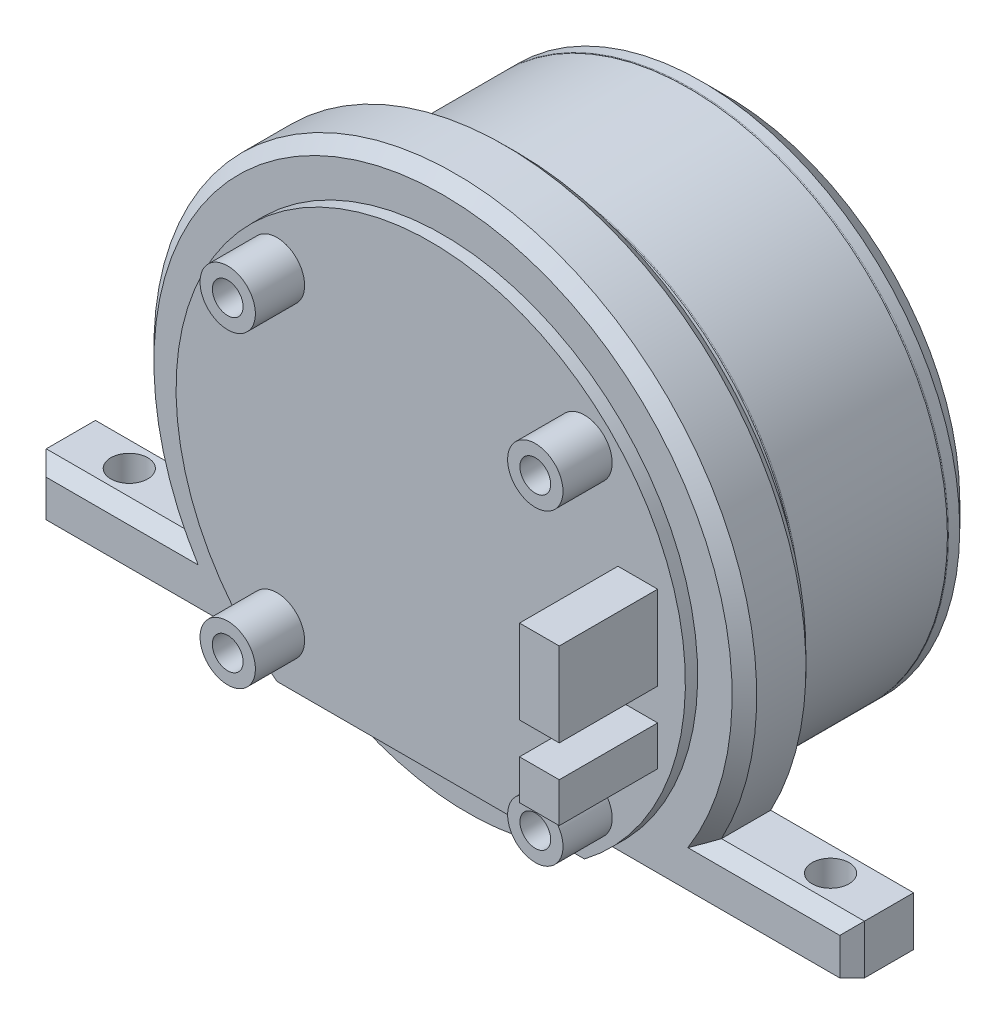
from build123d import *

# Parameters (mm, degrees)
SKETCH1_R               = 21
BOSS_EXTRUDE1_DEPTH     = 3
CHAMFER1_SIZE           = 2
FILLET1_R               = 0.1
SKETCH2_R               = 21
BOSS_EXTRUDE2_DEPTH     = 12
FILLET2_R               = 0.1
SKETCH3_R               = 21
BOSS_EXTRUDE3_DEPTH     = 6
SKETCH4_R               = 3
SKETCH4_R_2             = 1.5
CUT_EXTRUDE1_DEPTH      = 6
BOSS_EXTRUDE4_DEPTH     = 6
CHAMFER2_SIZE           = 1
CUT_EXTRUDE2_DEPTH      = 55.134670037
CUT_EXTRUDE2_DEPTH_BACK = 55.134670037
SKETCH6_R               = 1.5
BOSS_EXTRUDE5_DEPTH     = 1
SKETCH8_R               = 2.25
BOSS_EXTRUDE6_DEPTH     = 4
SKETCH9_R               = 1.25
CUT_EXTRUDE3_DEPTH      = 4
SKETCH10_W              = 3.229244049
SKETCH10_H              = 6.822780719
SKETCH10_H_2            = 3.229244049
BOSS_EXTRUDE7_DEPTH     = 8


with BuildPart() as part:
    # Sketch1 → Boss-Extrude1 (new body)
    with BuildSketch(Plane.XY):
        Circle(SKETCH1_R)
    extrude(amount=BOSS_EXTRUDE1_DEPTH)

    # Chamfer1
    chamfer1_edges = [part.edges().sort_by_distance(p)[0] for p in [
        (-21, 0, 0),
    ]]
    chamfer(chamfer1_edges, length=CHAMFER1_SIZE)

    # Fillet1
    fillet1_edges = [part.edges().sort_by_distance(p)[0] for p in [
        (-21, 0, 3),
    ]]
    fillet(fillet1_edges, radius=FILLET1_R)

    # Sketch2 → Boss-Extrude2 (add)
    with BuildSketch(Plane.XY.offset(3)):
        Circle(SKETCH2_R)
    extrude(amount=BOSS_EXTRUDE2_DEPTH)

    # Fillet2
    fillet2_edges = [part.edges().sort_by_distance(p)[0] for p in [
        (-21, 0, 15),
    ]]
    fillet(fillet2_edges, radius=FILLET2_R)

    # Sketch3 → Boss-Extrude3 (add)
    with BuildSketch(Plane.XY.offset(15)):
        Circle(SKETCH3_R)
    extrude(amount=BOSS_EXTRUDE3_DEPTH)

    # Sketch4 → Cut-Extrude1 (cut)
    with BuildSketch(Plane(origin=(0, 0, 0), x_dir=(-1, 0, 0), z_dir=(0, 0, -1))):
        Circle(SKETCH4_R)
        with Locations((-10, 0)):
            Circle(SKETCH4_R_2)
        with Locations((0, 10)):
            Circle(SKETCH4_R_2)
        with Locations((10, 0)):
            Circle(SKETCH4_R_2)
        with Locations((0, -10)):
            Circle(SKETCH4_R_2)
    extrude(amount=-CUT_EXTRUDE1_DEPTH, mode=Mode.SUBTRACT)

    # Sketch5 → Boss-Extrude4 (add)
    with BuildSketch(Plane.XY.offset(17)):
        with BuildLine():
            Line((21.633307653, -11.5), (33.25, -11.5))
            Line((33.25, -11.5), (33.25, -15.5))
            Line((33.25, -15.5), (-33.25, -15.5))
            Line((-33.25, -15.5), (-33.25, -11.5))
            Line((-33.25, -11.5), (-21.633307653, -11.5))
            ThreePointArc((-21.633307653, -11.5), (0, 24.5), (21.633307653, -11.5))
        make_face()
    extrude(amount=BOSS_EXTRUDE4_DEPTH)

    # Chamfer2
    chamfer2_edges = [part.edges().sort_by_distance(p)[0] for p in [
        (0, 24.5, 17),
        (0, 24.5, 23),
        (-33.25, -13.5, 17),
        (-27.441653826, -11.5, 17),
        (33.25, -13.5, 17),
        (27.441653826, -11.5, 17),
        (-33.25, -13.5, 23),
        (-27.441653826, -11.5, 23),
        (33.25, -13.5, 23),
        (27.441653826, -11.5, 23),
    ]]
    chamfer(chamfer2_edges, length=CHAMFER2_SIZE)

    # Sketch6 → Cut-Extrude2 (cut, two sides: drawn at the far end of the back side and taken through both)
    with BuildSketch(Plane(origin=(0, -11.5, 0), x_dir=(1, 0, 0), z_dir=(0, 1, 0)).offset(-CUT_EXTRUDE2_DEPTH_BACK)):
        with Locations((-28.5, -20)):
            Circle(SKETCH6_R)
        with Locations((28.5, -20)):
            Circle(SKETCH6_R)
    extrude(amount=CUT_EXTRUDE2_DEPTH + CUT_EXTRUDE2_DEPTH_BACK, mode=Mode.SUBTRACT)

    # Sketch7 → Boss-Extrude5 (add)
    with BuildSketch(Plane.XY.offset(23)):
        with BuildLine():
            Line((12.499599994, -16.5), (-12.499599994, -16.5))
            ThreePointArc((-12.499599994, -16.5), (0, 20.7), (12.499599994, -16.5))
        make_face()
    extrude(amount=BOSS_EXTRUDE5_DEPTH)

    # Sketch8 → Boss-Extrude6 (add)
    with BuildSketch(Plane.XY.offset(24)):
        with Locations((-12.5, 12.5)):
            Circle(SKETCH8_R)
        with Locations((12.5, 12.5)):
            Circle(SKETCH8_R)
        with Locations((12.5, -12.5)):
            Circle(SKETCH8_R)
        with Locations((-12.5, -12.5)):
            Circle(SKETCH8_R)
    extrude(amount=BOSS_EXTRUDE6_DEPTH)

    # Sketch9 → Cut-Extrude3 (cut)
    with BuildSketch(Plane.XY.offset(28)):
        with Locations((12.5, 12.5)):
            Circle(SKETCH9_R)
        with Locations((12.5, -12.5)):
            Circle(SKETCH9_R)
        with Locations((-12.5, 12.5)):
            Circle(SKETCH9_R)
        with Locations((-12.5, -12.5)):
            Circle(SKETCH9_R)
    extrude(amount=-CUT_EXTRUDE3_DEPTH, mode=Mode.SUBTRACT)

    # Sketch10 → Boss-Extrude7 (add)
    with BuildSketch(Plane.XY.offset(24)):
        with Locations((16.831288736, 2.056395103)):
            Rectangle(SKETCH10_W, SKETCH10_H)
        with Locations((16.831288736, -5.561216158)):
            Rectangle(SKETCH10_W, SKETCH10_H_2)
    extrude(amount=BOSS_EXTRUDE7_DEPTH)


solid = part.part
